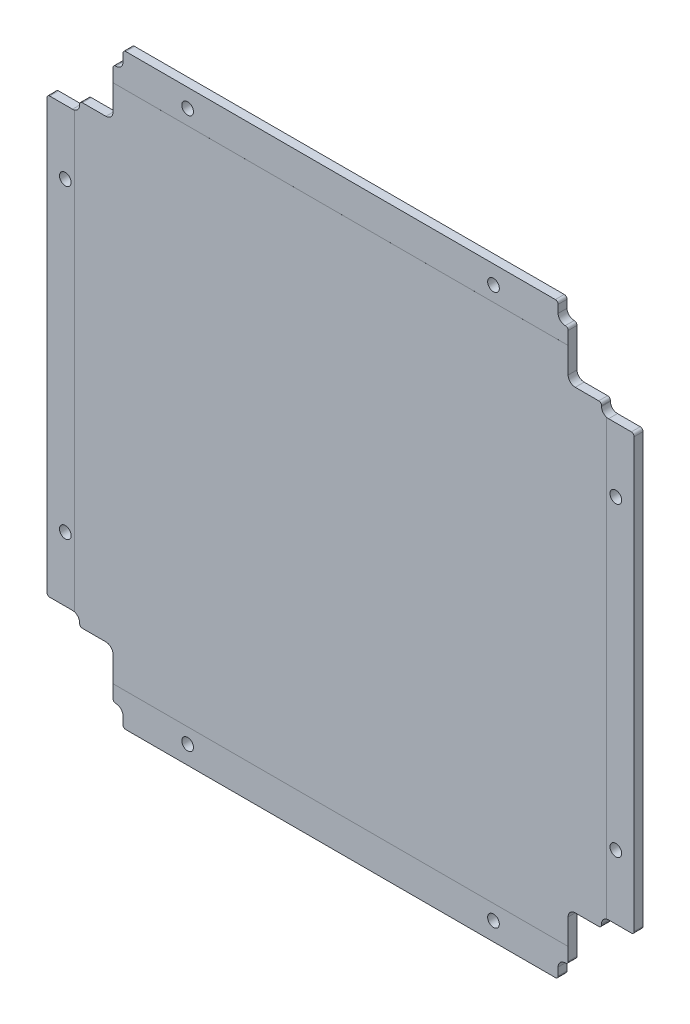
from build123d import *

# Parameters (mm, degrees)
SKETCH1_W                 = 106
SKETCH1_H                 = 106
MAINOUTLINE_DEPTH         = 1.6
SKETCH4_W                 = 11.7
SKETCH4_H                 = 11.7
RAILCUTOUTS_DEPTH         = 75.970394157
SKETCH13_W                = 5.7
SKETCH13_H                = 1.9
SKETCH13_W_2              = 1.8
SKETCH13_H_2              = 3
FILLETCUTOUTS_DEPTH       = 75.970394157
SMOOTHCORNER_DEPTH        = 10
MIRROR2_COPY_1_SKETCH_W   = 11.7
MIRROR2_COPY_1_SKETCH_H   = 11.7
MIRROR2_COPY_1_DEPTH      = 75.970394157
MIRROR2_COPY_2_SKETCH_W   = 5.7
MIRROR2_COPY_2_SKETCH_H   = 1.9
MIRROR2_COPY_2_SKETCH_W_2 = 1.8
MIRROR2_COPY_2_SKETCH_H_2 = 3
MIRROR2_COPY_2_DEPTH      = 75.970394157
MIRROR2_COPY_3_DEPTH      = 10
MIRROR2_COPY_4_SKETCH_W   = 11.7
MIRROR2_COPY_4_SKETCH_H   = 11.7
MIRROR2_COPY_4_DEPTH      = 75.970394157
MIRROR2_COPY_5_SKETCH_W   = 5.7
MIRROR2_COPY_5_SKETCH_H   = 1.9
MIRROR2_COPY_5_SKETCH_W_2 = 1.8
MIRROR2_COPY_5_SKETCH_H_2 = 3
MIRROR2_COPY_5_DEPTH      = 75.970394157
MIRROR2_COPY_6_DEPTH      = 10
FILLET10_R                = 0.5
M2_CLEARANCE_HOLE1_D      = 2.1
SKETCH16_W                = 90
SKETCH16_H                = 6.2
SKETCH16_W_2              = 5.2
SKETCH16_H_2              = 90
CUT_EXTRUDE6_DEPTH        = 0.001
SKETCH24_OUTSIDE_W        = 137.984
SKETCH24_OUTSIDE_H        = 137.984
SKETCH24_OUTSIDE_W_2      = 105.6
SKETCH24_OUTSIDE_H_2      = 105.6
CUT_EXTRUDE19_DEPTH       = 75.970394157
FILLET7_R                 = 0.5


with BuildPart() as part:
    # Sketch1 → mainOutline (new body)
    with BuildSketch(Plane.XY):
        Rectangle(SKETCH1_W, SKETCH1_H)
    extrude(amount=MAINOUTLINE_DEPTH)

    # Sketch4 → railCutouts (cut, through all)
    with BuildSketch(Plane(origin=(0, 0, 0), x_dir=(-1, 0, 0), z_dir=(0, 0, -1))):
        with Locations((47.15, 47.15)):
            Rectangle(SKETCH4_W, SKETCH4_H)
    railcutouts = extrude(amount=-RAILCUTOUTS_DEPTH, mode=Mode.SUBTRACT)

    # Sketch13 → filletCutouts (cut, symmetric)
    with BuildSketch(Plane(origin=(0, 0, 0), x_dir=(-1, 0, 0), z_dir=(0, 0, -1))):
        with Locations((50.15, 40.35)):
            Rectangle(SKETCH13_W, SKETCH13_H)
        with Locations((40.4, 51.5)):
            Rectangle(SKETCH13_W_2, SKETCH13_H_2)
    filletcutouts = extrude(amount=FILLETCUTOUTS_DEPTH, both=True, mode=Mode.SUBTRACT)

    # Sketch27 → smoothCorner (cut)
    with BuildSketch(Plane.XY.offset(1.6)):
        with BuildLine():
            Line((-40.928025612, 42.198025612), (-40.928025612, 49.628025612))
            Line((-40.928025612, 49.628025612), (-40.398025612, 49.628025612))
            ThreePointArc((-40.398025612, 49.628025612), (-39.5, 50), (-39.128025612, 50.898025612))
            Line((-39.128025612, 50.898025612), (-39.128025612, 53))
            Line((-39.128025612, 53), (-53, 53))
            Line((-53, 53), (-53, 39.028025612))
            Line((-53, 39.028025612), (-48.198025612, 39.028025612))
            ThreePointArc((-48.198025612, 39.028025612), (-47.3, 39.4), (-46.928025612, 40.298025612))
            Line((-46.928025612, 40.298025612), (-46.928025612, 40.928025612))
            Line((-46.928025612, 40.928025612), (-42.198025612, 40.928025612))
            ThreePointArc((-42.198025612, 40.928025612), (-41.3, 41.3), (-40.928025612, 42.198025612))
        make_face()
    smoothcorner = extrude(amount=-SMOOTHCORNER_DEPTH, mode=Mode.SUBTRACT)

    # Mirror1: railCutouts, filletCutouts, smoothCorner across plane
    add(railcutouts.mirror(Plane(origin=(0, 0, 0), x_dir=(0, 0, 1), z_dir=(1, 0, 0))), mode=Mode.SUBTRACT)
    add(filletcutouts.mirror(Plane(origin=(0, 0, 0), x_dir=(0, 0, 1), z_dir=(1, 0, 0))), mode=Mode.SUBTRACT)
    add(smoothcorner.mirror(Plane(origin=(0, 0, 0), x_dir=(0, 0, 1), z_dir=(1, 0, 0))), mode=Mode.SUBTRACT)

    # Mirror2 copy 1 sketch → Mirror2 copy 1 (cut, through all)
    with BuildSketch(Plane(origin=(0, 0, 0), x_dir=(1, 0, 0), z_dir=(0, 0, -1))):
        with Locations((47.15, 47.15)):
            Rectangle(MIRROR2_COPY_1_SKETCH_W, MIRROR2_COPY_1_SKETCH_H)
    extrude(amount=-MIRROR2_COPY_1_DEPTH, mode=Mode.SUBTRACT)

    # Mirror2 copy 2 sketch → Mirror2 copy 2 (cut, symmetric)
    with BuildSketch(Plane(origin=(0, 0, 0), x_dir=(1, 0, 0), z_dir=(0, 0, -1))):
        with Locations((50.15, 40.35)):
            Rectangle(MIRROR2_COPY_2_SKETCH_W, MIRROR2_COPY_2_SKETCH_H)
        with Locations((40.4, 51.5)):
            Rectangle(MIRROR2_COPY_2_SKETCH_W_2, MIRROR2_COPY_2_SKETCH_H_2)
    extrude(amount=MIRROR2_COPY_2_DEPTH, both=True, mode=Mode.SUBTRACT)

    # Mirror2 copy 3 sketch → Mirror2 copy 3 (cut)
    with BuildSketch(Plane(origin=(0, 0, 1.6), x_dir=(-1, 0, 0), z_dir=(0, 0, 1))):
        with BuildLine():
            Line((-40.928025612, 42.198025612), (-40.928025612, 49.628025612))
            Line((-40.928025612, 49.628025612), (-40.398025612, 49.628025612))
            ThreePointArc((-40.398025612, 49.628025612), (-39.5, 50), (-39.128025612, 50.898025612))
            Line((-39.128025612, 50.898025612), (-39.128025612, 53))
            Line((-39.128025612, 53), (-53, 53))
            Line((-53, 53), (-53, 39.028025612))
            Line((-53, 39.028025612), (-48.198025612, 39.028025612))
            ThreePointArc((-48.198025612, 39.028025612), (-47.3, 39.4), (-46.928025612, 40.298025612))
            Line((-46.928025612, 40.298025612), (-46.928025612, 40.928025612))
            Line((-46.928025612, 40.928025612), (-42.198025612, 40.928025612))
            ThreePointArc((-42.198025612, 40.928025612), (-41.3, 41.3), (-40.928025612, 42.198025612))
        make_face()
    extrude(amount=-MIRROR2_COPY_3_DEPTH, mode=Mode.SUBTRACT)

    # Mirror2 copy 4 sketch → Mirror2 copy 4 (cut, through all)
    with BuildSketch(Plane(origin=(0, 0, 0), x_dir=(-1, 0, 0), z_dir=(0, 0, -1))):
        with Locations((47.15, -47.15)):
            Rectangle(MIRROR2_COPY_4_SKETCH_W, MIRROR2_COPY_4_SKETCH_H)
    extrude(amount=-MIRROR2_COPY_4_DEPTH, mode=Mode.SUBTRACT)

    # Mirror2 copy 5 sketch → Mirror2 copy 5 (cut, symmetric)
    with BuildSketch(Plane(origin=(0, 0, 0), x_dir=(-1, 0, 0), z_dir=(0, 0, -1))):
        with Locations((50.15, -40.35)):
            Rectangle(MIRROR2_COPY_5_SKETCH_W, MIRROR2_COPY_5_SKETCH_H)
        with Locations((40.4, -51.5)):
            Rectangle(MIRROR2_COPY_5_SKETCH_W_2, MIRROR2_COPY_5_SKETCH_H_2)
    extrude(amount=MIRROR2_COPY_5_DEPTH, both=True, mode=Mode.SUBTRACT)

    # Mirror2 copy 6 sketch → Mirror2 copy 6 (cut)
    with BuildSketch(Plane.XY.offset(1.6)):
        with BuildLine():
            Line((-40.928025612, -42.198025612), (-40.928025612, -49.628025612))
            Line((-40.928025612, -49.628025612), (-40.398025612, -49.628025612))
            ThreePointArc((-40.398025612, -49.628025612), (-39.5, -50), (-39.128025612, -50.898025612))
            Line((-39.128025612, -50.898025612), (-39.128025612, -53))
            Line((-39.128025612, -53), (-53, -53))
            Line((-53, -53), (-53, -39.028025612))
            Line((-53, -39.028025612), (-48.198025612, -39.028025612))
            ThreePointArc((-48.198025612, -39.028025612), (-47.3, -39.4), (-46.928025612, -40.298025612))
            Line((-46.928025612, -40.298025612), (-46.928025612, -40.928025612))
            Line((-46.928025612, -40.928025612), (-42.198025612, -40.928025612))
            ThreePointArc((-42.198025612, -40.928025612), (-41.3, -41.3), (-40.928025612, -42.198025612))
        make_face()
    extrude(amount=-MIRROR2_COPY_6_DEPTH, mode=Mode.SUBTRACT)

    # Fillet10
    fillet10_edges = [part.edges().sort_by_distance(p)[0] for p in [
        (46.928025612, -40.928025612, 0.8),
        (40.928025612, -49.628025612, 0.8),
        (40.928025612, 49.628025612, 0.8),
        (46.928025612, 40.928025612, 0.8),
        (-46.928025612, 40.928025612, 0.8),
        (-40.928025612, 49.628025612, 0.8),
        (-46.928025612, -40.928025612, 0.8),
        (-40.928025612, -49.628025612, 0.8),
    ]]
    fillet(fillet10_edges, radius=FILLET10_R)

    # M2 Clearance Hole1 (through all)
    with Locations(Plane(origin=(0, 0, 0), x_dir=(-1, 0, 0), z_dir=(0, 0, -1))):
        with Locations((49.5, -27.5), (27.5, -49.5), (-49.5, -27.5), (-27.5, -49.5), (-27.5, 49.5), (-49.5, 27.5), (27.5, 49.5), (49.5, 27.5)):
            Hole(M2_CLEARANCE_HOLE1_D / 2)

    # Sketch16 → Cut-Extrude6 (cut)
    with BuildSketch(Plane.XY.offset(1.6)):
        with Locations((0, -49.9)):
            Rectangle(SKETCH16_W, SKETCH16_H)
        with Locations((0, 49.9)):
            Rectangle(SKETCH16_W, SKETCH16_H)
        with Locations((-50.4, 0)):
            Rectangle(SKETCH16_W_2, SKETCH16_H_2)
        with Locations((50.4, 0)):
            Rectangle(SKETCH16_W_2, SKETCH16_H_2)
    extrude(amount=-CUT_EXTRUDE6_DEPTH, mode=Mode.SUBTRACT)

    # Sketch24 outside → Cut-Extrude19 (cut, through all)
    with BuildSketch(Plane.XY.offset(1.6)):
        Rectangle(SKETCH24_OUTSIDE_W, SKETCH24_OUTSIDE_H)
        Rectangle(SKETCH24_OUTSIDE_W_2, SKETCH24_OUTSIDE_H_2, mode=Mode.SUBTRACT)
    extrude(amount=-CUT_EXTRUDE19_DEPTH, mode=Mode.SUBTRACT)

    # Fillet7
    fillet7_edges = [part.edges().sort_by_distance(p)[0] for p in [
        (-52.8, -39.028025612, 0.7995),
        (-39.128025612, -52.8, 0.7995),
        (39.128025612, -52.8, 0.7995),
        (52.8, -39.028025612, 0.7995),
        (52.8, 39.028025612, 0.7995),
        (39.128025612, 52.8, 0.7995),
        (-39.128025612, 52.8, 0.7995),
        (-52.8, 39.028025612, 0.7995),
    ]]
    fillet(fillet7_edges, radius=FILLET7_R)


solid = part.part
